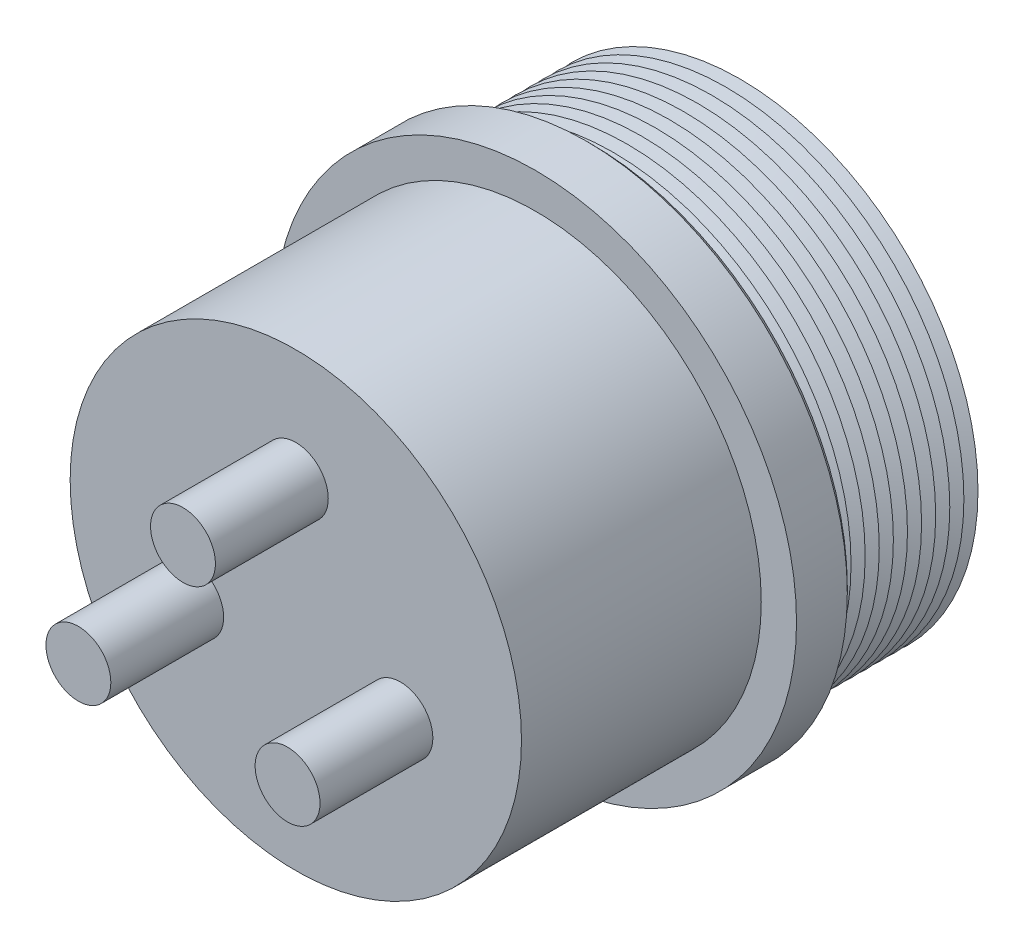
from build123d import *

# Parameters (mm, degrees)
ESBO_O1_R                     = 8
RESSALTO_EXTRUS_O1_DEPTH      = 16
RESSALTO_EXTRUS_O3_START      = -2
ESBO_O3_R                     = 9.25
ESBO_O3_R_2                   = 8
RESSALTO_EXTRUS_O3_DEPTH      = 2
ESBO_O4_R                     = 7
CORTE_EXTRUS_O1_DEPTH         = 10
RESSALTO_EXTRUS_O2_DEPTH      = 4
RESSALTO_EXTRUS_O2_DEPTH_BACK = 16
ESBO_O2_R                     = 1.15
FILETE1_R                     = 1
PADR_O_LINEAR1_COUNT          = 11
PADR_O_LINEAR1_PITCH          = 0.5
CHANFRO1_SIZE                 = 0.2


with BuildPart() as part:
    # Esboço1 → Ressalto-extrusão1 (new body)
    with BuildSketch(Plane.XY):
        Circle(ESBO_O1_R)
    extrude(amount=RESSALTO_EXTRUS_O1_DEPTH)

    # Esboço3 → Ressalto-extrusão3 (add)
    with BuildSketch(Plane.XY.offset(7.5).offset(RESSALTO_EXTRUS_O3_START)):
        Circle(ESBO_O3_R)
        Circle(ESBO_O3_R_2, mode=Mode.SUBTRACT)
    extrude(amount=RESSALTO_EXTRUS_O3_DEPTH)

    # Esboço4 → Corte-extrusão1 (cut)
    with BuildSketch(Plane(origin=(0, 0, 0), x_dir=(-1, 0, 0), z_dir=(0, 0, -1))):
        Circle(ESBO_O4_R)
    extrude(amount=-CORTE_EXTRUS_O1_DEPTH, mode=Mode.SUBTRACT)

    # Esboço2 → Ressalto-extrusão2 (add, two sides: drawn at the far end of the back side and taken through both)
    with BuildSketch(Plane.XY.offset(16).offset(-RESSALTO_EXTRUS_O2_DEPTH_BACK)):
        with Locations((0, 4)):
            Circle(ESBO_O2_R)
        with Locations((3.708099244, -1.5)):
            Circle(ESBO_O2_R)
        with Locations((-3.708099244, -1.5)):
            Circle(ESBO_O2_R)
    extrude(amount=RESSALTO_EXTRUS_O2_DEPTH + RESSALTO_EXTRUS_O2_DEPTH_BACK)

    # Filete1
    filete1_edges = [part.edges().sort_by_distance(p)[0] for p in [
        (2.558099244, -1.5, 0),
        (-4.858099244, -1.5, 0),
        (-1.15, 4, 0),
    ]]
    fillet(filete1_edges, radius=FILETE1_R)

    # Esboço5 → Revolução1 (revolve)
    with BuildSketch(Plane(origin=(0, 0, 0), x_dir=(1, 0, 0), z_dir=(0, 1, 0)), mode=Mode.PRIVATE) as revolu_o1_sk:
        Polygon((8, 0), (8.433012702, -0.25), (8, -0.5), align=None)
    revolu_o1 = revolve(revolu_o1_sk.sketch.rotate(Axis((0, 0, -3.692698903), (0, 0, 1)), 180), axis=Axis((0, 0, -3.692698903), (0, 0, 1)))

    # Padrão linear1: Revolução1 ×11
    with Locations(*[(0, 0, i * PADR_O_LINEAR1_PITCH) for i in range(1, PADR_O_LINEAR1_COUNT)]):
        add(revolu_o1)

    # Chanfro1
    chanfro1_edges = [part.edges().sort_by_distance(p)[0] for p in [
        (-9.25, 0, 5.5),
    ]]
    chamfer(chanfro1_edges, length=CHANFRO1_SIZE)


solid = part.part
